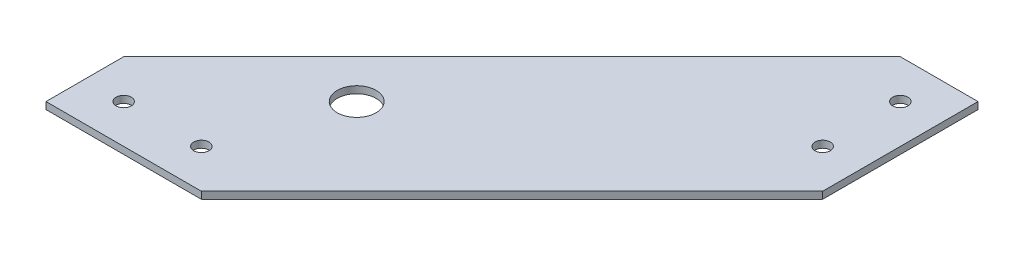
from build123d import *

# Parameters (mm, degrees)
SKETCH1_R           = 2.4892
SKETCH1_R_2         = 6.35
BOSS_EXTRUDE2_DEPTH = 1.143
CUT_EXTRUDE1_DEPTH  = 216.53826991
BOSS_EXTRUDE3_DEPTH = 2.286


with BuildPart() as part:
    # Sketch1 → Boss-Extrude2 (new, symmetric)
    with BuildSketch(Plane(origin=(0, 0, 0), x_dir=(1, 0, 0), z_dir=(0, 1, 0))):
        Polygon((0, 0), (0, 152.4), (-25.4, 152.4), (-152.4, 25.4), (-152.4, 0), align=None)
        with Locations((-12.7, 12.7)):
            Circle(SKETCH1_R, mode=Mode.SUBTRACT)
        with Locations((-38.1, 12.7)):
            Circle(SKETCH1_R, mode=Mode.SUBTRACT)
        with Locations((-63.5, 12.7)):
            Circle(SKETCH1_R, mode=Mode.SUBTRACT)
        with Locations((-88.9, 12.7)):
            Circle(SKETCH1_R, mode=Mode.SUBTRACT)
        with Locations((-114.3, 12.7)):
            Circle(SKETCH1_R, mode=Mode.SUBTRACT)
        with Locations((-12.7, 38.1)):
            Circle(SKETCH1_R, mode=Mode.SUBTRACT)
        with Locations((-12.7, 63.5)):
            Circle(SKETCH1_R, mode=Mode.SUBTRACT)
        with Locations((-12.7, 88.9)):
            Circle(SKETCH1_R, mode=Mode.SUBTRACT)
        with Locations((-12.7, 114.3)):
            Circle(SKETCH1_R, mode=Mode.SUBTRACT)
        with Locations((-139.7, 12.7)):
            Circle(SKETCH1_R, mode=Mode.SUBTRACT)
        with Locations((-12.7, 139.7)):
            Circle(SKETCH1_R, mode=Mode.SUBTRACT)
        with Locations((-101.6, 50.8)):
            Circle(SKETCH1_R_2, mode=Mode.SUBTRACT)
    extrude(amount=BOSS_EXTRUDE2_DEPTH, both=True)

    # Sketch2 → Cut-Extrude1 (cut, through all)
    with BuildSketch(Plane(origin=(0, 1.143, 0), x_dir=(1, 0, 0), z_dir=(0, 1, 0))):
        Polygon((0, 0), (0, 101.6), (-101.6, 0), align=None)
    extrude(amount=-CUT_EXTRUDE1_DEPTH, mode=Mode.SUBTRACT)

    # Sketch3 → Boss-Extrude3 (add)
    with BuildSketch(Plane(origin=(0, 1.143, 0), x_dir=(1, 0, 0), z_dir=(0, 1, 0))):
        Polygon((-101.6, 0), (-101.6, 15.120409187), (-15.612291765, 101.108117422), (0, 101.6), align=None)
    extrude(amount=-BOSS_EXTRUDE3_DEPTH)


solid = part.part
